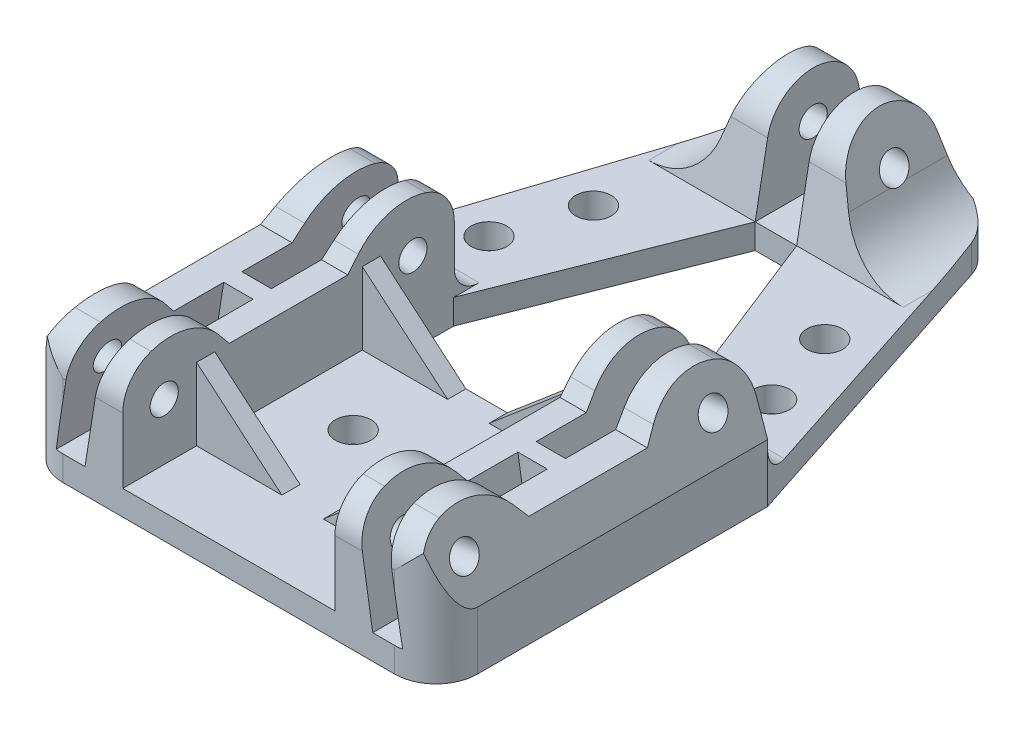
from build123d import *

# Parameters (mm, degrees)
BOSS_EXTRUDE1_DEPTH                        = 3
SKETCH2_R                                  = 1.7
BOSS_EXTRUDE2_DEPTH                        = 7
CUT_EXTRUDE1_DEPTH                         = 10
FILLET1_R                                  = 8
FILLET1_OF_MIRROR1_R                       = 8
BOSS_EXTRUDE4_DEPTH                        = 20
CUT_EXTRUDE2_DEPTH                         = 28
SKETCH8_R                                  = 1.7
CUT_EXTRUDE3_DEPTH                         = 16
BOSS_EXTRUDE17_DEPTH                       = 1.1
RIB29_REACH                                = 78.033
SKETCH25_WALL_W                            = 167.563564406
SKETCH25_WALL_H                            = 2.2
MIRROR17_AT_THE_SECOND_PLANE_COPY_1_DEPTH  = 20
MIRROR17_AT_THE_SECOND_PLANE_COPY_2_DEPTH  = 28
MIRROR17_AT_THE_SECOND_PLANE_COPY_3_SKET_R = 1.7
MIRROR17_AT_THE_SECOND_PLANE_COPY_3_DEPTH  = 16
MIRROR17_AT_THE_SECOND_PLANE_COPY_4_DEPTH  = 1.1
MIRROR17_AT_THE_SECOND_PLANE_COPY_5_REACH  = 78.033
MIRROR17_AT_THE_SECOND_PLANE_COPY_5_SKET_W = 167.563564406
MIRROR17_AT_THE_SECOND_PLANE_COPY_5_SKET_H = 2.2
FILLET28_R                                 = 5
FILLET29_R                                 = 3
SKETCH31_R                                 = 2.15
CUT_EXTRUDE13_DEPTH                        = 15
FILLET31_R                                 = 5
CUT_EXTRUDE16_DEPTH                        = 26


with BuildPart() as part:
    # Sketch1 → Boss-Extrude1 (new body)
    with BuildSketch(Plane(origin=(0, 0, 0), x_dir=(1, 0, 0), z_dir=(0, 1, 0))):
        Polygon((-25, 0), (25, 0), (25, 40), (11.938797241, 80), (-11.938797241, 80), (-25, 40), align=None)
    extrude(amount=BOSS_EXTRUDE1_DEPTH)

    # Sketch2 → Boss-Extrude2 (add)
    with BuildSketch(Plane(origin=(2.5, 0, 0), x_dir=(0, 0, -1), z_dir=(1, 0, 0))):
        with BuildLine():
            Line((67.5, 11.027692569), (65.439440417, 0))
            Line((65.439440417, 0), (80, 0))
            Line((80, 0), (80, 3))
            Line((80, 3), (78.5, 11.027692569))
            ThreePointArc((78.5, 11.027692569), (73, 15.595190079), (67.5, 11.027692569))
        make_face()
        with Locations((73, 10)):
            Circle(SKETCH2_R, mode=Mode.SUBTRACT)
    boss_extrude2 = extrude(amount=BOSS_EXTRUDE2_DEPTH)

    # Sketch3 → Cut-Extrude1 (cut, symmetric)
    with BuildSketch(Plane(origin=(0, 0, -73), x_dir=(-1, 0, 0), z_dir=(0, 0, -1))):
        Polygon((-5.5, 15.595190079), (-9.5, 3), (-9.5, 15.595190079), align=None)
    cut_extrude1 = extrude(amount=CUT_EXTRUDE1_DEPTH, both=True, mode=Mode.SUBTRACT)

    # Fillet1
    # the kernel refuses this fillet: 8 mm, written as the material it adds along each edge
    with BuildSketch(Plane(origin=(9.5, 3, -51.367274546), x_dir=(1, 0, 0), z_dir=(0, 0, -1))) as fillet1_piece_1_section:
        with BuildLine():
            CenterArc((FILLET1_R * 0.731636272702, -FILLET1_R), FILLET1_R, 90, 72.381112159)
            Line((-FILLET1_R * 0.221454665552, -FILLET1_R * 0.69731590161), (0, 0))
            Line((0, 0), (FILLET1_R * 0.731636272702, 0))
        make_face()
    fillet1_piece_1 = extrude(amount=28.632725454, mode=Mode.PRIVATE)
    fillet1_piece_1 = split(fillet1_piece_1, bisect_by=Plane(origin=(13.901664909, 4.236506099, -73.988707766), z_dir=(-0.9506056088786227, 0, 0.310401315023798)), keep=Keep.TOP, mode=Mode.PRIVATE)
    fillet1_piece_1 = split(fillet1_piece_1, bisect_by=Plane(origin=(10.280523732, 5.423664208, -66.452869399), z_dir=(0, -0.18367429070645971, -0.9829871590888046)), keep=Keep.TOP, mode=Mode.PRIVATE)
    fillet1_piece_1 = split(fillet1_piece_1, bisect_by=Plane(origin=(10.280523732, 5.493610413, -79.534060929), z_dir=(0, -0.183674290706459, 0.982987159088805)), keep=Keep.TOP, mode=Mode.PRIVATE)
    fillet1_piece_1 = fillet1_piece_1 - Plane(origin=(10.280523732, 10, -73), x_dir=(0, 0, -1), z_dir=(-1, 0, 0)) * Cylinder(1.7, 81, mode=Mode.PRIVATE)
    add(fillet1_piece_1)

    # Mirror1: Boss-Extrude2, Cut-Extrude1 across plane
    add(boss_extrude2.mirror(Plane(origin=(0, 0, 0), x_dir=(0, 0, 1), z_dir=(1, 0, 0))))
    add(cut_extrude1.mirror(Plane(origin=(0, 0, 0), x_dir=(0, 0, 1), z_dir=(1, 0, 0))), mode=Mode.SUBTRACT)

    # Fillet1 of Mirror1
    # the kernel refuses this fillet: 8 mm, written as the material it adds along each edge
    with BuildSketch(Plane(origin=(-9.5, 3, -51.367274546), x_dir=(-1, 0, 0), z_dir=(0, 0, -1))) as fillet1_of_mirror1_piece_1_section:
        with BuildLine():
            CenterArc((FILLET1_OF_MIRROR1_R * 0.731636272702, FILLET1_OF_MIRROR1_R), FILLET1_OF_MIRROR1_R, 197.618887841, 72.381112159)
            Line((-FILLET1_OF_MIRROR1_R * 0.221454665552, FILLET1_OF_MIRROR1_R * 0.69731590161), (0, 0))
            Line((0, 0), (FILLET1_OF_MIRROR1_R * 0.731636272702, 0))
        make_face()
    fillet1_of_mirror1_piece_1 = extrude(amount=28.632725454, mode=Mode.PRIVATE)
    fillet1_of_mirror1_piece_1 = split(fillet1_of_mirror1_piece_1, bisect_by=Plane(origin=(-13.901664909, 4.236506099, -73.988707766), z_dir=(0.9506056088786227, 0, 0.310401315023798)), keep=Keep.TOP, mode=Mode.PRIVATE)
    fillet1_of_mirror1_piece_1 = split(fillet1_of_mirror1_piece_1, bisect_by=Plane(origin=(-10.280523732, 5.423664208, -66.452869399), z_dir=(0, -0.18367429070645971, -0.9829871590888046)), keep=Keep.TOP, mode=Mode.PRIVATE)
    fillet1_of_mirror1_piece_1 = split(fillet1_of_mirror1_piece_1, bisect_by=Plane(origin=(-10.280523732, 5.493610413, -79.534060929), z_dir=(0, -0.183674290706459, 0.982987159088805)), keep=Keep.TOP, mode=Mode.PRIVATE)
    fillet1_of_mirror1_piece_1 = fillet1_of_mirror1_piece_1 - Plane(origin=(-10.280523732, 10, -73), x_dir=(0, 0, -1), z_dir=(1, 0, 0)) * Cylinder(1.7, 81, mode=Mode.PRIVATE)
    add(fillet1_of_mirror1_piece_1)

    # Sketch6 → Boss-Extrude4 (add)
    with BuildSketch(Plane.XY):
        Polygon((20.89916596, 3), (18.840168236, 16), (21.840168236, 16), (25, 7), (25, 3), align=None)
        Polygon((17.35553802, 3), (15.296540296, 16), (12.796540296, 16), (12.796540296, 3), align=None)
    boss_extrude4 = extrude(amount=-BOSS_EXTRUDE4_DEPTH)

    # Sketch7 → Cut-Extrude2 (cut)
    with BuildSketch(Plane(origin=(0, 0, 0), x_dir=(0, 0, -1), z_dir=(1, 0, 0))):
        with BuildLine():
            ThreePointArc((5.79227433, 16), (8.995160535, 15.281704798), (11.584548661, 13.264405323))
            Line((11.584548661, 13.264405323), (12.84861315, 11.727632568))
            Line((12.84861315, 11.727632568), (20, 11.727632568))
            Line((20, 11.727632568), (20, 16))
            Line((20, 16), (10, 16))
            Line((10, 16), (5.79227433, 16))
        make_face()
        with BuildLine():
            ThreePointArc((0, 13.264405323), (2.589388126, 15.281704798), (5.79227433, 16))
            Line((5.79227433, 16), (0, 16))
            Line((0, 16), (0, 13.264405323))
        make_face()
    cut_extrude2 = extrude(amount=CUT_EXTRUDE2_DEPTH, mode=Mode.SUBTRACT)

    # Sketch8 → Cut-Extrude3 (cut, symmetric)
    with BuildSketch(Plane(origin=(20.851252457, 3.302513951, 0), x_dir=(0, 0, 1), z_dir=(-0.9876883405951371, -0.15643446504023534, 0))):
        with Locations(Location((-5, 7.693715175, 0), (0, 0, 90))):
            Circle(SKETCH8_R)
    cut_extrude3 = extrude(amount=CUT_EXTRUDE3_DEPTH, both=True, mode=Mode.SUBTRACT)

    # Sketch22 → Boss-Extrude17 (add)
    with BuildSketch(Plane.XY.offset(-20)):
        Polygon((12.796540296, 11.727632568), (23.340164049, 11.727632568), (25, 7), (25, 3), (20.89916596, 3), (12.796540296, 3), align=None)
    boss_extrude17 = extrude(amount=BOSS_EXTRUDE17_DEPTH)

    # Sketch25 wall → Rib29 (add, up to next)
    with BuildSketch(Plane(origin=(7.648270148, 7.363816284, -10), x_dir=(0.762831614206, 0.646597191741, 0), z_dir=(-0.646597191741, 0.762831614206, 0)), mode=Mode.PRIVATE) as rib29_sk1:
        Rectangle(SKETCH25_WALL_W, SKETCH25_WALL_H)
    rib29_tool1 = extrude(rib29_sk1.sketch, amount=-RIB29_REACH, mode=Mode.PRIVATE) - part.part
    rib29 = rib29_tool1.solids().sort_by_distance((7.648270148, 7.363816284, -10))[0]
    add(rib29)

    # Mirror17: Boss-Extrude4, Cut-Extrude2, Cut-Extrude3, Boss-Extrude17, Rib29 across plane
    add(boss_extrude4.mirror(Plane(origin=(0, 0, 0), x_dir=(0, 0, 1), z_dir=(1, 0, 0))))
    add(cut_extrude2.mirror(Plane(origin=(0, 0, 0), x_dir=(0, 0, 1), z_dir=(1, 0, 0))), mode=Mode.SUBTRACT)
    add(cut_extrude3.mirror(Plane(origin=(0, 0, 0), x_dir=(0, 0, 1), z_dir=(1, 0, 0))), mode=Mode.SUBTRACT)
    add(boss_extrude17.mirror(Plane(origin=(0, 0, 0), x_dir=(0, 0, 1), z_dir=(1, 0, 0))))
    add(rib29.mirror(Plane(origin=(0, 0, 0), x_dir=(0, 0, 1), z_dir=(1, 0, 0))))

    # Mirror17 at the second plane: Boss-Extrude4, Cut-Extrude2, Cut-Extrude3, Boss-Extrude17, Rib29 across plane
    add(boss_extrude4.mirror(Plane.XY.offset(-20)))
    add(cut_extrude2.mirror(Plane.XY.offset(-20)), mode=Mode.SUBTRACT)
    add(cut_extrude3.mirror(Plane.XY.offset(-20)), mode=Mode.SUBTRACT)
    add(boss_extrude17.mirror(Plane.XY.offset(-20)))
    add(rib29.mirror(Plane.XY.offset(-20)))

    # Mirror17 at the second plane copy 1 sket → Mirror17 at the second plane copy 1 (add)
    with BuildSketch(Plane(origin=(0, 0, -40), x_dir=(-1, 0, 0), z_dir=(0, 0, -1))):
        Polygon((20.89916596, 3), (18.840168236, 16), (21.840168236, 16), (25, 7), (25, 3), align=None)
        Polygon((17.35553802, 3), (15.296540296, 16), (12.796540296, 16), (12.796540296, 3), align=None)
    extrude(amount=-MIRROR17_AT_THE_SECOND_PLANE_COPY_1_DEPTH)

    # Mirror17 at the second plane copy 2 sket → Mirror17 at the second plane copy 2 (cut)
    with BuildSketch(Plane(origin=(0, 0, -40), x_dir=(0, 0, 1), z_dir=(-1, 0, 0))):
        with BuildLine():
            ThreePointArc((5.79227433, 16), (8.995160535, 15.281704798), (11.584548661, 13.264405323))
            Line((11.584548661, 13.264405323), (12.84861315, 11.727632568))
            Line((12.84861315, 11.727632568), (20, 11.727632568))
            Line((20, 11.727632568), (20, 16))
            Line((20, 16), (10, 16))
            Line((10, 16), (5.79227433, 16))
        make_face()
        with BuildLine():
            ThreePointArc((0, 13.264405323), (2.589388126, 15.281704798), (5.79227433, 16))
            Line((5.79227433, 16), (0, 16))
            Line((0, 16), (0, 13.264405323))
        make_face()
    extrude(amount=MIRROR17_AT_THE_SECOND_PLANE_COPY_2_DEPTH, mode=Mode.SUBTRACT)

    # Mirror17 at the second plane copy 3 sket → Mirror17 at the second plane copy 3 (cut, symmetric)
    with BuildSketch(Plane(origin=(-20.851252457, 3.302513951, -40), x_dir=(0, 0, -1), z_dir=(0.9876883405951371, -0.15643446504023534, 0))):
        with Locations(Location((-5, 7.693715175, 0), (0, 0, 90))):
            Circle(MIRROR17_AT_THE_SECOND_PLANE_COPY_3_SKET_R)
    extrude(amount=MIRROR17_AT_THE_SECOND_PLANE_COPY_3_DEPTH, both=True, mode=Mode.SUBTRACT)

    # Mirror17 at the second plane copy 4 sket → Mirror17 at the second plane copy 4 (add)
    with BuildSketch(Plane(origin=(0, 0, -20), x_dir=(-1, 0, 0), z_dir=(0, 0, -1))):
        Polygon((12.796540296, 11.727632568), (23.340164049, 11.727632568), (25, 7), (25, 3), (20.89916596, 3), (12.796540296, 3), align=None)
    extrude(amount=MIRROR17_AT_THE_SECOND_PLANE_COPY_4_DEPTH)

    # Mirror17 at the second plane copy 5 sket → Mirror17 at the second plane copy 5 (add, up to next)
    with BuildSketch(Plane(origin=(-7.648270148, 7.363816284, -30), x_dir=(-0.762831614206, 0.646597191741, 0), z_dir=(0.646597191741, 0.762831614206, 0)), mode=Mode.PRIVATE) as mirror17_at_the_second_plane_copy_5_sk1:
        Rectangle(MIRROR17_AT_THE_SECOND_PLANE_COPY_5_SKET_W, MIRROR17_AT_THE_SECOND_PLANE_COPY_5_SKET_H)
    mirror17_at_the_second_plane_copy_5_tool1 = extrude(mirror17_at_the_second_plane_copy_5_sk1.sketch, amount=-MIRROR17_AT_THE_SECOND_PLANE_COPY_5_REACH, mode=Mode.PRIVATE) - part.part
    add(mirror17_at_the_second_plane_copy_5_tool1.solids().sort_by_distance((-7.648270148, 7.363816284, -30))[0])

    # Fillet28
    fillet28_edges = [part.edges().sort_by_distance(p)[0] for p in [
        (21.037029327, 13.264405323, 0),
        (14.263178112, 13.264405323, 0),
        (14.263178112, 13.264405323, -40),
        (21.037029327, 13.264405323, -40),
        (-21.037029327, 13.264405323, 0),
        (-14.263178112, 13.264405323, 0),
        (-14.263178112, 13.264405323, -40),
        (-21.037029327, 13.264405323, -40),
    ]]
    fillet(fillet28_edges, radius=FILLET28_R)

    # Fillet29
    fillet29_edges = [part.edges().sort_by_distance(p)[0] for p in [
        (22.94958298, 3, -40),
        (15.076039158, 3, -40),
        (-22.94958298, 3, -40),
        (-15.076039158, 3, -40),
    ]]
    fillet(fillet29_edges, radius=FILLET29_R)

    # Sketch31 → Cut-Extrude13 (cut)
    with BuildSketch(Plane(origin=(0, 15, 0), x_dir=(1, 0, 0), z_dir=(0, 1, 0))):
        with Locations(Location((-13.949960606, 57.941121237, 0), (0, 0, 270))):
            Circle(SKETCH31_R)
        with Locations(Location((-17.053973756, 48.435065148, 0), (0, 0, 270))):
            Circle(SKETCH31_R)
        with Locations(Location((17.053973756, 48.435065148, 0), (0, 0, 270))):
            Circle(SKETCH31_R)
        with Locations(Location((13.949960606, 57.941121237, 0), (0, 0, 270))):
            Circle(SKETCH31_R)
        with Locations(Location((5, 20, 0), (0, 0, 270))):
            Circle(SKETCH31_R)
        with Locations(Location((-5, 20, 0), (0, 0, 270))):
            Circle(SKETCH31_R)
    extrude(amount=-CUT_EXTRUDE13_DEPTH, mode=Mode.SUBTRACT)

    # Fillet31
    # the kernel refuses this fillet: 5 mm, written as the material it takes off along each edge
    with BuildSketch(Plane(origin=(25, 19.5, 0), x_dir=(0, 0, -1), z_dir=(0, -1, 0)), Plane(origin=(-25, 19.5, 0), x_dir=(1, 0, 0), z_dir=(0, -1, 0))) as fillet31_piece_1:
        with BuildLine():
            CenterArc((FILLET31_R, -FILLET31_R), FILLET31_R, 90, 90)
            Line((0, -FILLET31_R), (0, 0))
            Line((0, 0), (FILLET31_R, 0))
        make_face()
    extrude(amount=32, mode=Mode.SUBTRACT)
    with BuildSketch(Plane(origin=(11.938797241, -9.067886284, -80), x_dir=(0.3104013150238678, 0, 0.9506056088785999), z_dir=(0, 1, 0)), Plane(origin=(-11.938797241, -9.067886284, -80), x_dir=(1, 0, 0), z_dir=(0, 1, 0))) as fillet31_piece_2:
        with BuildLine():
            CenterArc((FILLET31_R * 0.725430902716, -FILLET31_R), FILLET31_R, 90, 71.916582746)
            Line((-FILLET31_R * 0.225174706162, -FILLET31_R * 0.689598684976), (0, 0))
            Line((0, 0), (FILLET31_R * 0.725430902716, 0))
        make_face()
    extrude(amount=21.135772568, mode=Mode.SUBTRACT)

    # Sketch32 → Cut-Extrude16 (cut)
    with BuildSketch(Plane(origin=(0, 0, 0), x_dir=(1, 0, 0), z_dir=(0, 1, 0))):
        Polygon((-12.796540296, 39.926095737), (-2.5, 66), (2.5, 66), (12.796540296, 39.926095737), (12.796540296, 31.1), (-12.796540296, 31.1), align=None)
    extrude(amount=CUT_EXTRUDE16_DEPTH, mode=Mode.SUBTRACT)


solid = part.part
